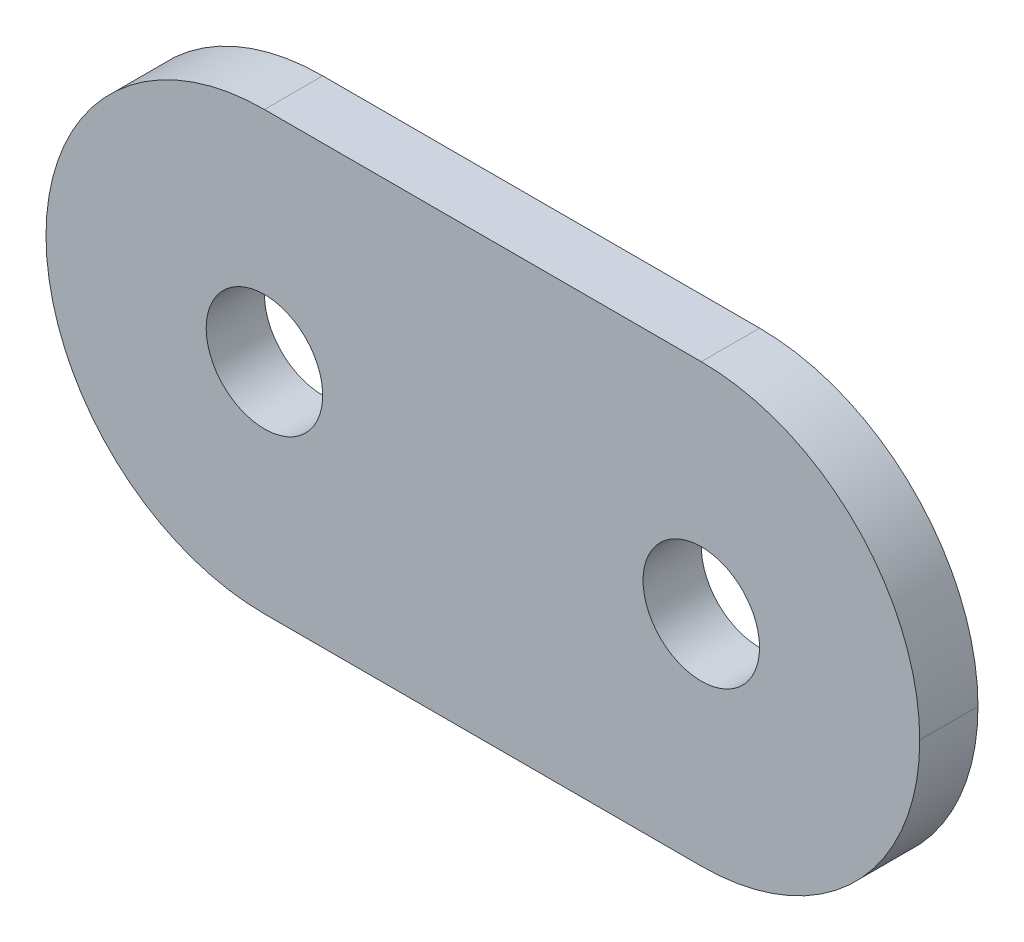
from build123d import *

# Parameters (mm, degrees)
SKETCH_1_W          = 30
SKETCH_1_H          = 15
EXTRUDE_1_DEPTH     = 2
FILLET_1_R          = 7.5
SKETCH_2_R          = 2
CUT_EXTRUDE_1_DEPTH = 2


with BuildPart() as part:
    # 草图1 → 凸台-拉伸1 (new body)
    with BuildSketch(Plane.XY):
        Rectangle(SKETCH_1_W, SKETCH_1_H)
    extrude(amount=EXTRUDE_1_DEPTH)

    # 圆角1
    fillet_1_edges = [part.edges().sort_by_distance(p)[0] for p in [
        (15, -7.5, 1),
        (-15, -7.5, 1),
        (-15, 7.5, 1),
        (15, 7.5, 1),
    ]]
    fillet(fillet_1_edges, radius=FILLET_1_R - 0.0001)  # a hair under: the kernel refuses the full size

    # 草图2 → 切除-拉伸1 (cut)
    with BuildSketch(Plane.XY.offset(2)):
        with Locations((7.5, 0)):
            Circle(SKETCH_2_R)
        with Locations(Location((-7.5, 0, 0), (0, 0, 180))):
            Circle(SKETCH_2_R)
    extrude(amount=-CUT_EXTRUDE_1_DEPTH, mode=Mode.SUBTRACT)


solid = part.part
